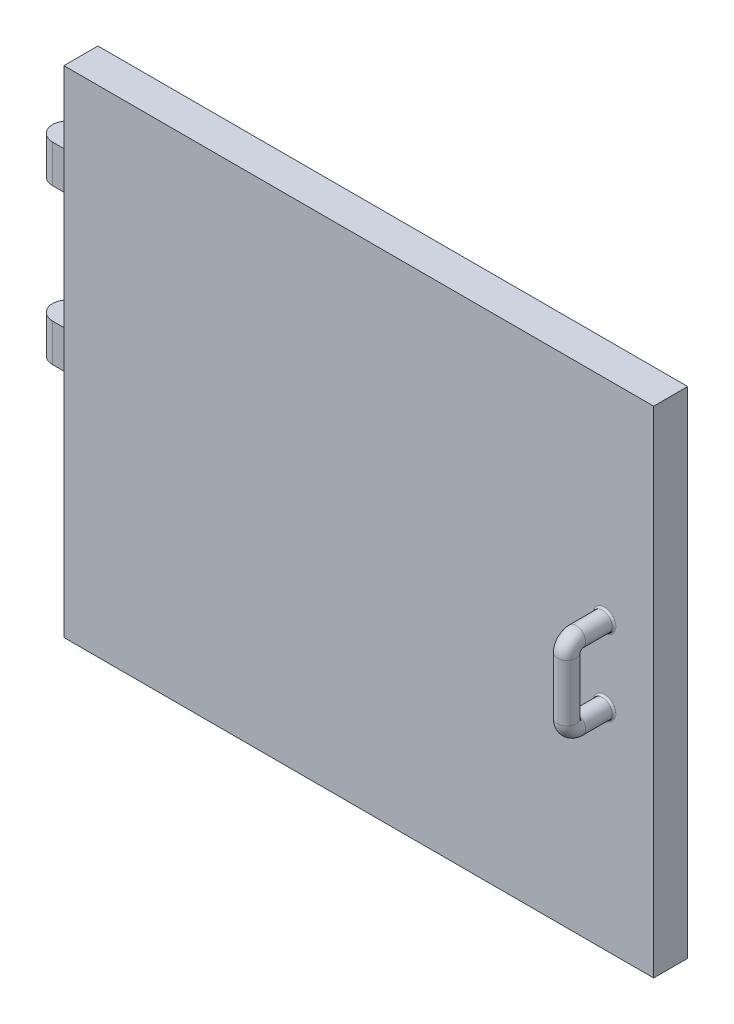
from build123d import *

# Parameters (mm, degrees)
CROQUIS2_W              = 312
CROQUIS2_H              = 262
SALIENTE_EXTRUIR1_DEPTH = 8
CROQUIS3_W              = 312
CROQUIS3_H              = 262
CROQUIS3_W_2            = 306
CROQUIS3_H_2            = 256
SALIENTE_EXTRUIR2_DEPTH = 10
CROQUIS6_W              = 16
CROQUIS6_H              = 20
SALIENTE_EXTRUIR6_DEPTH = 8
SALIENTE_EXTRUIR7_DEPTH = 20
SALIENTE_EXTRUIR8_DEPTH = 20
CROQUIS9_R              = 3.5
CORTAR_EXTRUIR1_DEPTH   = 5
CROQUIS10_R             = 3.5
CORTAR_EXTRUIR2_DEPTH   = 5
BARRER7_PROFILE_R       = 5
REDONDEO1_R             = 1


with BuildPart() as part:
    # Croquis2 → Saliente-Extruir1 (new body)
    with BuildSketch(Plane.XY):
        Rectangle(CROQUIS2_W, CROQUIS2_H)
    extrude(amount=SALIENTE_EXTRUIR1_DEPTH)

    # Croquis3 → Saliente-Extruir2 (add)
    with BuildSketch(Plane(origin=(0, 0, 0), x_dir=(-1, 0, 0), z_dir=(0, 0, -1))):
        Rectangle(CROQUIS3_W, CROQUIS3_H)
        Rectangle(CROQUIS3_W_2, CROQUIS3_H_2, mode=Mode.SUBTRACT)
    extrude(amount=SALIENTE_EXTRUIR2_DEPTH)

    # Croquis6 → Saliente-Extruir6 (add)
    with BuildSketch(Plane.ZY.offset(156)):
        with Locations((-2, 81)):
            Rectangle(CROQUIS6_W, CROQUIS6_H)
        with Locations((-2, -1)):
            Rectangle(CROQUIS6_W, CROQUIS6_H)
    extrude(amount=SALIENTE_EXTRUIR6_DEPTH)

    # Croquis7 → Saliente-Extruir7 (add)
    with BuildSketch(Plane(origin=(0, 91, 0), x_dir=(1, 0, 0), z_dir=(0, 1, 0))):
        with BuildLine():
            Line((-164, 10), (-164, -6))
            ThreePointArc((-164, -6), (-172, 2), (-164, 10))
        make_face()
    extrude(amount=-SALIENTE_EXTRUIR7_DEPTH)

    # Croquis8 → Saliente-Extruir8 (add)
    with BuildSketch(Plane(origin=(0, 9, 0), x_dir=(1, 0, 0), z_dir=(0, 1, 0))):
        with BuildLine():
            Line((-164, 10), (-164, -6))
            ThreePointArc((-164, -6), (-172, 2), (-164, 10))
        make_face()
    extrude(amount=-SALIENTE_EXTRUIR8_DEPTH)

    # Croquis9 → Cortar-Extruir1 (cut)
    with BuildSketch(Plane.XZ.offset(-71)):
        with Locations((-164, -2)):
            Circle(CROQUIS9_R)
    extrude(amount=-CORTAR_EXTRUIR1_DEPTH, mode=Mode.SUBTRACT)

    # Croquis10 → Cortar-Extruir2 (cut)
    with BuildSketch(Plane.XZ.offset(11)):
        with Locations((-164, -2)):
            Circle(CROQUIS10_R)
    extrude(amount=-CORTAR_EXTRUIR2_DEPTH, mode=Mode.SUBTRACT)

    # Barrer7: sweep along a path in Croquis13
    with BuildLine(Plane(origin=(130, 0, 0), x_dir=(0, 0, -1), z_dir=(1, 0, 0))) as barrer7_path:
        Line((-8, 20), (-23, 20))
        ThreePointArc((-23, 20), (-26.535533906, 18.535533906), (-28, 15))
        Line((-28, 15), (-28, -15))
        ThreePointArc((-28, -15), (-26.535533906, -18.535533906), (-23, -20))
        Line((-23, -20), (-8, -20))
    # Barrer7 profile (on start of the path) → Barrer7 (sweep)
    with BuildSketch(Plane(origin=(130, 20, 8), x_dir=(0, 1, 0), z_dir=(0, 0, 1))):
        Circle(BARRER7_PROFILE_R)
    sweep(path=barrer7_path.line)

    # Redondeo1
    redondeo1_edges = [part.edges().sort_by_distance(p)[0] for p in [
        (130, -15, 8),
        (130, 15, 8),
    ]]
    fillet(redondeo1_edges, radius=REDONDEO1_R)


solid = part.part
